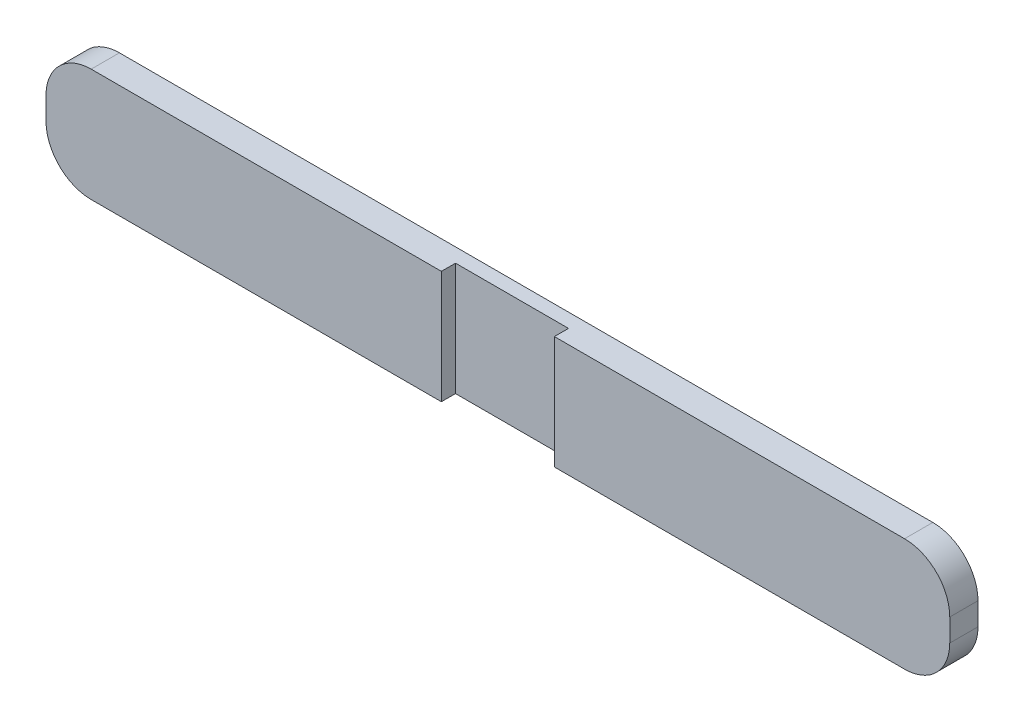
from build123d import *

# Parameters (mm, degrees)
BOSS_EXTRUDE1_DEPTH = 1.5875
SKETCH3_W           = 6.35
SKETCH3_H           = 6.35
CUT_EXTRUDE1_DEPTH  = 0.79375


with BuildPart() as part:
    # Sketch2 → Boss-Extrude1 (new body)
    with BuildSketch(Plane.XY):
        with BuildLine():
            Line((-17.532195122, 1.796585366), (28.187804878, 1.796585366))
            ThreePointArc((28.187804878, 1.796585366), (29.983856102, 1.05263659), (30.727804878, -0.743414634))
            Line((30.727804878, -0.743414634), (30.727804878, -2.013414634))
            ThreePointArc((30.727804878, -2.013414634), (29.983856102, -3.809465858), (28.187804878, -4.553414634))
            Line((28.187804878, -4.553414634), (-17.532195122, -4.553414634))
            ThreePointArc((-17.532195122, -4.553414634), (-19.328246346, -3.809465858), (-20.072195122, -2.013414634))
            Line((-20.072195122, -2.013414634), (-20.072195122, -0.743414634))
            ThreePointArc((-20.072195122, -0.743414634), (-19.328246346, 1.05263659), (-17.532195122, 1.796585366))
        make_face()
    extrude(amount=BOSS_EXTRUDE1_DEPTH)

    # Sketch3 → Cut-Extrude1 (cut)
    with BuildSketch(Plane.XY.offset(1.5875)):
        with Locations((5.327804878, -1.378414634)):
            Rectangle(SKETCH3_W, SKETCH3_H)
    extrude(amount=-CUT_EXTRUDE1_DEPTH, mode=Mode.SUBTRACT)


solid = part.part
